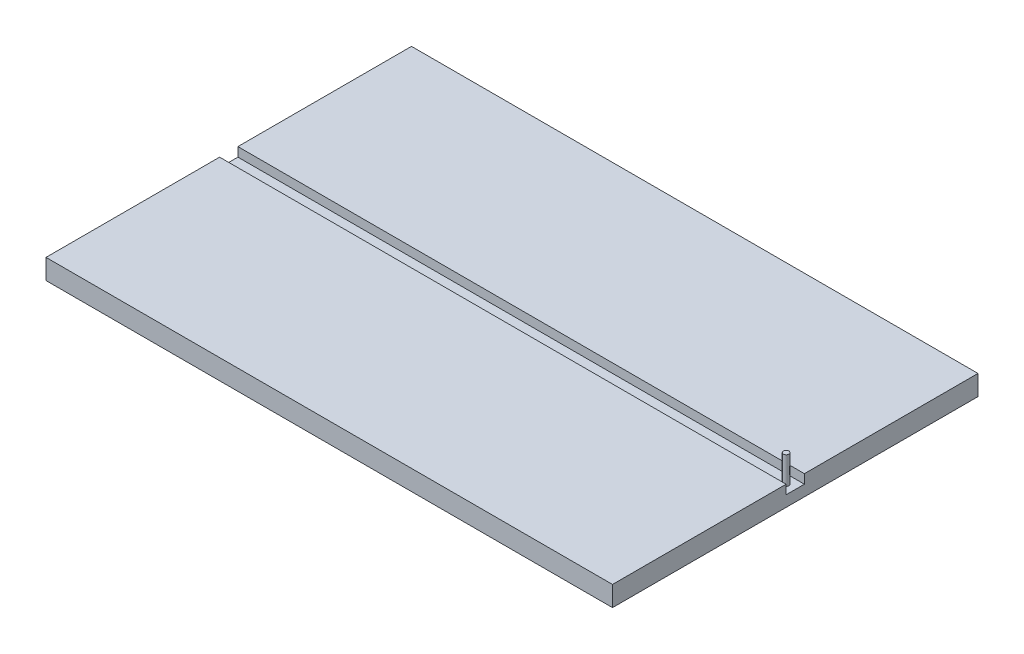
from build123d import *

# Parameters (mm, degrees)
SKETCH1_W           = 310
SKETCH1_H           = 200
BOSS_EXTRUDE1_DEPTH = 6
SKETCH2_W           = 310
SKETCH2_H           = 95
BOSS_EXTRUDE2_DEPTH = 5
SKETCH3_R           = 1.5
BOSS_EXTRUDE3_DEPTH = 15


with BuildPart() as part:
    # Sketch1 → Boss-Extrude1 (new body)
    with BuildSketch(Plane(origin=(0, 0, 0), x_dir=(1, 0, 0), z_dir=(0, 1, 0))):
        with Locations((155, 100)):
            Rectangle(SKETCH1_W, SKETCH1_H)
    extrude(amount=BOSS_EXTRUDE1_DEPTH)

    # Sketch2 → Boss-Extrude2 (add)
    with BuildSketch(Plane(origin=(0, 6, 0), x_dir=(1, 0, 0), z_dir=(0, 1, 0))):
        with Locations((155, 47.5)):
            Rectangle(SKETCH2_W, SKETCH2_H)
        with Locations((155, 152.5)):
            Rectangle(SKETCH2_W, SKETCH2_H)
    extrude(amount=BOSS_EXTRUDE2_DEPTH)

    # Sketch3 → Boss-Extrude3 (add)
    with BuildSketch(Plane(origin=(0, 6, 0), x_dir=(1, 0, 0), z_dir=(0, 1, 0))):
        with Locations((305, 100)):
            Circle(SKETCH3_R)
    extrude(amount=BOSS_EXTRUDE3_DEPTH)


solid = part.part
